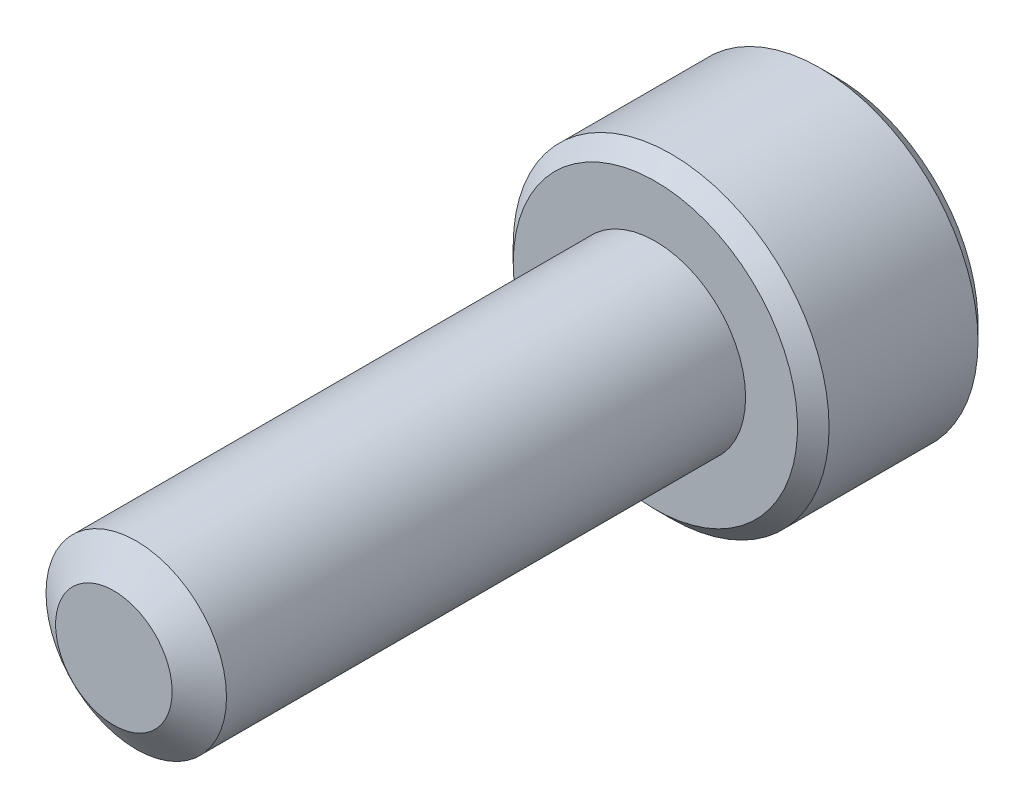
from build123d import *

# Parameters (mm, degrees)
SKETCH1_R          = 2
EXTRUDE1_DEPTH     = 12
SKETCH6_R          = 3.5
EXTRUDE2_DEPTH     = 4
CUT_EXTRUDE1_DEPTH = 2.25
CHAMFER1_SIZE      = 0.35


with BuildPart() as part:
    # Sketch1 → Extrude1 (new body)
    with BuildSketch(Plane.XY):
        Circle(SKETCH1_R)
    extrude(amount=-EXTRUDE1_DEPTH)

    # Sketch4 → Cut-Revolve1 (revolve, cut)
    with BuildSketch(Plane(origin=(0, 0, 0), x_dir=(0, 0, -1), z_dir=(1, 0, 0))):
        Polygon((0.496211411, 2), (0, 1.291336663), (0, 2), align=None)
    revolve(axis=Axis((0, 0, 0), (0, 0, -1)), mode=Mode.SUBTRACT)

    # Sketch6 → Extrude2 (add)
    with BuildSketch(Plane(origin=(0, 0, -12), x_dir=(-1, 0, 0), z_dir=(0, 0, -1))):
        Circle(SKETCH6_R)
    extrude(amount=EXTRUDE2_DEPTH)

    # Sketch7 → Cut-Extrude1 (cut)
    with BuildSketch(Plane(origin=(0, 0, -16), x_dir=(-1, 0, 0), z_dir=(0, 0, -1))):
        Polygon((0, 1.732050808), (-1.5, 0.866025404), (-1.5, -0.866025404), (0, -1.732050808), (1.5, -0.866025404), (1.5, 0.866025404), align=None)
    extrude(amount=-CUT_EXTRUDE1_DEPTH, mode=Mode.SUBTRACT)

    # Cut-Extrude2 cone 1 section (through the dimple's axis) → Cut-Extrude2 (revolve, cut)
    with BuildSketch(Plane(origin=(0, 0, -16), x_dir=(0, 1, 0), z_dir=(1, 0, 0))):
        Polygon((0, 0), (1.732050808, 0), (0, 1.732050808), align=None)
    revolve(axis=Axis((0, 0, -16), (0, 0, 1)), mode=Mode.SUBTRACT)

    # Chamfer1
    chamfer1_edges = [part.edges().sort_by_distance(p)[0] for p in [
        (3.5, 0, -16),
        (3.5, 0, -12),
    ]]
    chamfer(chamfer1_edges, length=CHAMFER1_SIZE)


solid = part.part
